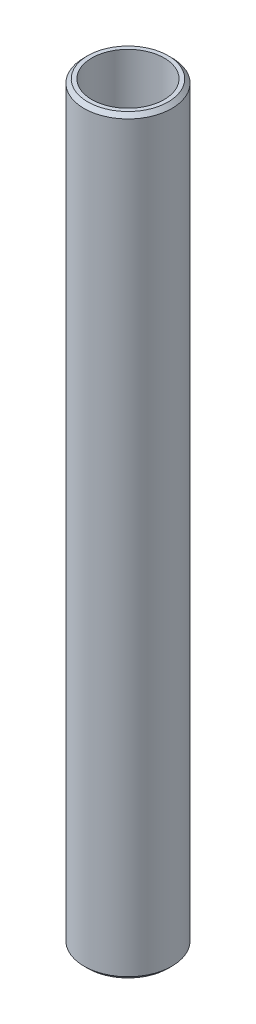
from build123d import *

# Parameters (mm, degrees)
SKETCH1_R           = 35
BOSS_EXTRUDE1_DEPTH = 598.066929256
SKETCH2_R           = 28.792275849
CUT_EXTRUDE1_DEPTH  = 601.111699494
CHAMFER1_SIZE       = 2.995984782


with BuildPart() as part:
    # Sketch1 → Boss-Extrude1 (new body)
    with BuildSketch(Plane(origin=(0, 0, 0), x_dir=(1, 0, 0), z_dir=(0, 1, 0))):
        Circle(SKETCH1_R)
    extrude(amount=BOSS_EXTRUDE1_DEPTH)

    # Sketch2 → Cut-Extrude1 (cut, through all)
    with BuildSketch(Plane(origin=(0, 0, 0), x_dir=(1, 0, 0), z_dir=(0, 1, 0))):
        Circle(SKETCH2_R)
    extrude(amount=CUT_EXTRUDE1_DEPTH, mode=Mode.SUBTRACT)

    # Chamfer1
    chamfer1_edges = [part.edges().sort_by_distance(p)[0] for p in [
        (-35, 598.066929256, 0),
        (-35, 0, 0),
    ]]
    chamfer(chamfer1_edges, length=CHAMFER1_SIZE)


solid = part.part
